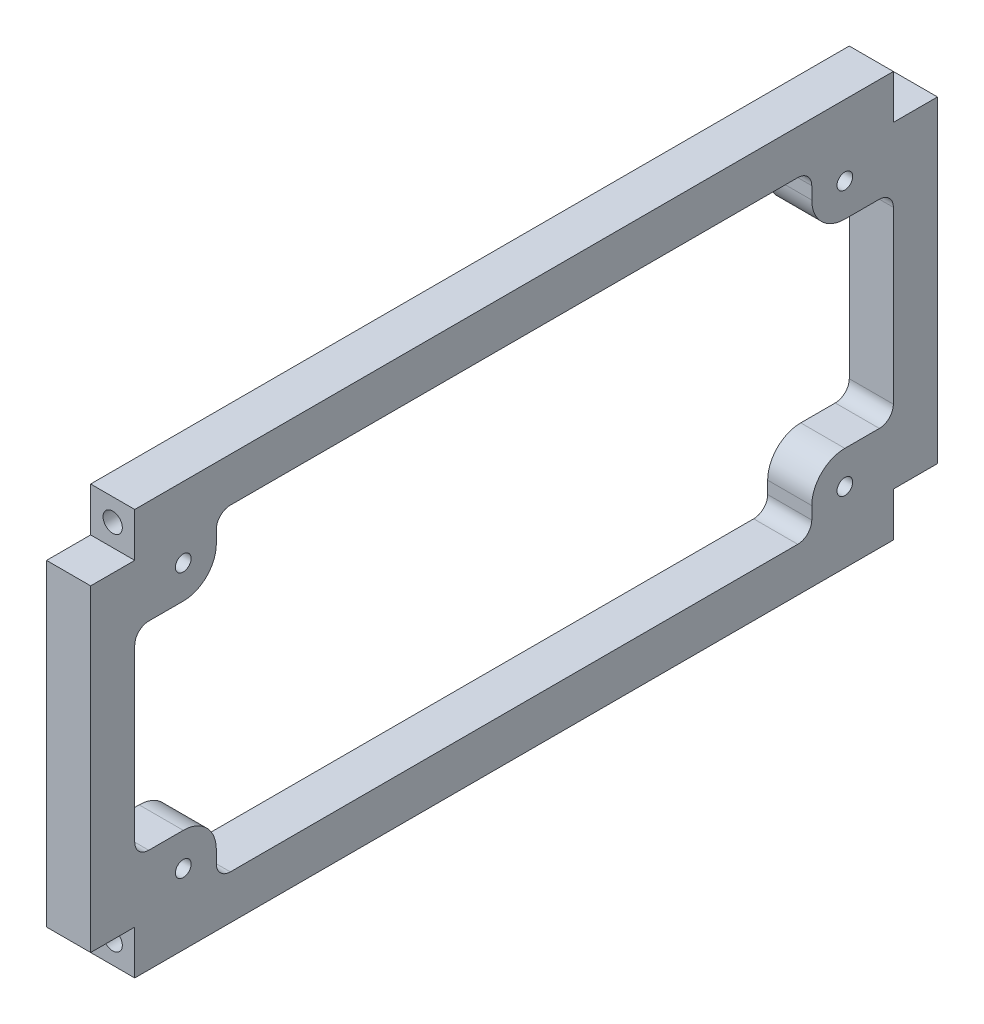
from build123d import *

# Parameters (mm, degrees)
BOSS_EXTRUDE2_DEPTH       = 5
SKETCH3_R                 = 1.0922
CUT_EXTRUDE2_DEPTH        = 2.2625
MIRROR27_START            = 3.5922
MIRROR27_DEPTH            = 1.4078
MIRROR27_2_DEPTH          = 1.4077999
MIRROR27_START_2          = 1.4077999
MIRROR27_3_DEPTH          = 2.1844001
MIRROR27_START_3          = -93
MIRROR27_4_OUTLINE_R      = 1.0922
MIRROR27_4_DEPTH          = 2.2625
TAP_DRILL_FOR_2_56_TAP1_D = 1.778


with BuildPart() as part:
    # Sketch1 → Boss-Extrude2 (new body)
    with BuildSketch(Plane(origin=(0, 0, 0), x_dir=(0, 0, -1), z_dir=(1, 0, 0))):
        with BuildLine():
            Line((2, 25), (7, 25))
            Line((7, 25), (7, 15.3375))
            ThreePointArc((7, 15.3375), (7.464967985, 14.214967985), (8.5875, 13.75))
            Line((8.5875, 13.75), (12.5, 13.75))
            ThreePointArc((12.5, 13.75), (15.151650429, 12.651650429), (16.25, 10))
            Line((16.25, 10), (16.25, 8.5875))
            ThreePointArc((16.25, 8.5875), (16.714967985, 7.464967985), (17.8375, 7))
            Line((17.8375, 7), (50, 7))
            Line((50, 7), (50, 2))
            Line((50, 2), (7, 2))
            Line((7, 2), (7, 7))
            Line((7, 7), (2, 7))
            Line((2, 7), (2, 25))
        make_face()
    boss_extrude2 = extrude(amount=BOSS_EXTRUDE2_DEPTH)

    # Sketch3 → Cut-Extrude2 (cut)
    with BuildSketch(Plane.XY.offset(-7)):
        with Locations((2.5, 4.5)):
            Circle(SKETCH3_R)
    cut_extrude2 = extrude(amount=-CUT_EXTRUDE2_DEPTH, mode=Mode.SUBTRACT)

    # Mirror26: Boss-Extrude2, Cut-Extrude2 across plane
    add(boss_extrude2.mirror(Plane.ZX.offset(25)))
    add(cut_extrude2.mirror(Plane.ZX.offset(25)), mode=Mode.SUBTRACT)

    # Mirror27: read off the stored shape, not the designer's step
    # Mirror27 outline → Mirror27 (add)
    with BuildSketch(Plane.YZ.offset(MIRROR27_START)):
        with BuildLine():
            ThreePointArc((15.3375, -93), (14.214967985, -92.535032015), (13.75, -91.4125))
            Line((13.75, -91.4125), (13.75, -87.5))
            ThreePointArc((13.75, -87.5), (12.651650429, -84.848349571), (10, -83.75))
            Line((10, -83.75), (8.5875, -83.75))
            ThreePointArc((8.5875, -83.75), (7.464967985, -83.285032015), (7, -82.1625))
            Line((7, -82.1625), (7, -50))
            Line((7, -50), (2, -50))
            Line((2, -50), (2, -93))
            Line((2, -93), (7, -93))
            Line((7, -93), (7, -98))
            Line((7, -98), (43, -98))
            Line((43, -98), (43, -93))
            Line((43, -93), (48, -93))
            Line((48, -93), (48, -50))
            Line((48, -50), (43, -50))
            Line((43, -50), (43, -82.1625))
            ThreePointArc((43, -82.1625), (42.535032015, -83.285032015), (41.4125, -83.75))
            Line((41.4125, -83.75), (40, -83.75))
            ThreePointArc((40, -83.75), (37.348349571, -84.848349571), (36.25, -87.5))
            Line((36.25, -87.5), (36.25, -91.4125))
            ThreePointArc((36.25, -91.4125), (35.785032015, -92.535032015), (34.6625, -93))
            Line((34.6625, -93), (15.3375, -93))
        make_face()
    extrude(amount=MIRROR27_DEPTH)

    # Mirror27 2 outline → Mirror27 2 (add)
    with BuildSketch(Plane.YZ):
        with BuildLine():
            ThreePointArc((15.3375, -93), (14.214967985, -92.535032015), (13.75, -91.4125))
            Line((13.75, -91.4125), (13.75, -87.5))
            ThreePointArc((13.75, -87.5), (12.651650429, -84.848349571), (10, -83.75))
            Line((10, -83.75), (8.5875, -83.75))
            ThreePointArc((8.5875, -83.75), (7.464967985, -83.285032015), (7, -82.1625))
            Line((7, -82.1625), (7, -50))
            Line((7, -50), (2, -50))
            Line((2, -50), (2, -93))
            Line((2, -93), (7, -93))
            Line((7, -93), (7, -98))
            Line((7, -98), (43, -98))
            Line((43, -98), (43, -93))
            Line((43, -93), (48, -93))
            Line((48, -93), (48, -50))
            Line((48, -50), (43, -50))
            Line((43, -50), (43, -82.1625))
            ThreePointArc((43, -82.1625), (42.535032015, -83.285032015), (41.4125, -83.75))
            Line((41.4125, -83.75), (40, -83.75))
            ThreePointArc((40, -83.75), (37.348349571, -84.848349571), (36.25, -87.5))
            Line((36.25, -87.5), (36.25, -91.4125))
            ThreePointArc((36.25, -91.4125), (35.785032015, -92.535032015), (34.6625, -93))
            Line((34.6625, -93), (15.3375, -93))
        make_face()
    extrude(amount=MIRROR27_2_DEPTH)

    # Mirror27 3 outline → Mirror27 3 (add)
    with BuildSketch(Plane.YZ.offset(MIRROR27_START_2)):
        with BuildLine():
            ThreePointArc((15.3375, -93), (14.214967985, -92.535032015), (13.75, -91.4125))
            Line((13.75, -91.4125), (13.75, -87.5))
            ThreePointArc((13.75, -87.5), (12.651650429, -84.848349571), (10, -83.75))
            Line((10, -83.75), (8.5875, -83.75))
            ThreePointArc((8.5875, -83.75), (7.464967985, -83.285032015), (7, -82.1625))
            Line((7, -82.1625), (7, -50))
            Line((7, -50), (2, -50))
            Line((2, -50), (2, -93))
            Line((2, -93), (7, -93))
            Line((7, -93), (7, -98))
            Line((7, -98), (43, -98))
            Line((43, -98), (43, -93))
            Line((43, -93), (48, -93))
            Line((48, -93), (48, -50))
            Line((48, -50), (43, -50))
            Line((43, -50), (43, -82.1625))
            ThreePointArc((43, -82.1625), (42.535032015, -83.285032015), (41.4125, -83.75))
            Line((41.4125, -83.75), (40, -83.75))
            ThreePointArc((40, -83.75), (37.348349571, -84.848349571), (36.25, -87.5))
            Line((36.25, -87.5), (36.25, -91.4125))
            ThreePointArc((36.25, -91.4125), (35.785032015, -92.535032015), (34.6625, -93))
            Line((34.6625, -93), (15.3375, -93))
        make_face()
    extrude(amount=MIRROR27_3_DEPTH)

    # Mirror27 4 outline → Mirror27 4 (cut)
    with BuildSketch(Plane.XY.offset(MIRROR27_START_3)):
        with Locations((2.5, 4.5)):
            Circle(MIRROR27_4_OUTLINE_R)
        with Locations((2.5, 45.5)):
            Circle(MIRROR27_4_OUTLINE_R)
    extrude(amount=MIRROR27_4_DEPTH, mode=Mode.SUBTRACT)

    # Tap Drill for #2-56 Tap1 (through all)
    with Locations(Plane.ZY):
        with Locations((-87.5, 10), (-87.5, 40), (-12.5, 40), (-12.5, 10)):
            Hole(TAP_DRILL_FOR_2_56_TAP1_D / 2)


solid = part.part
